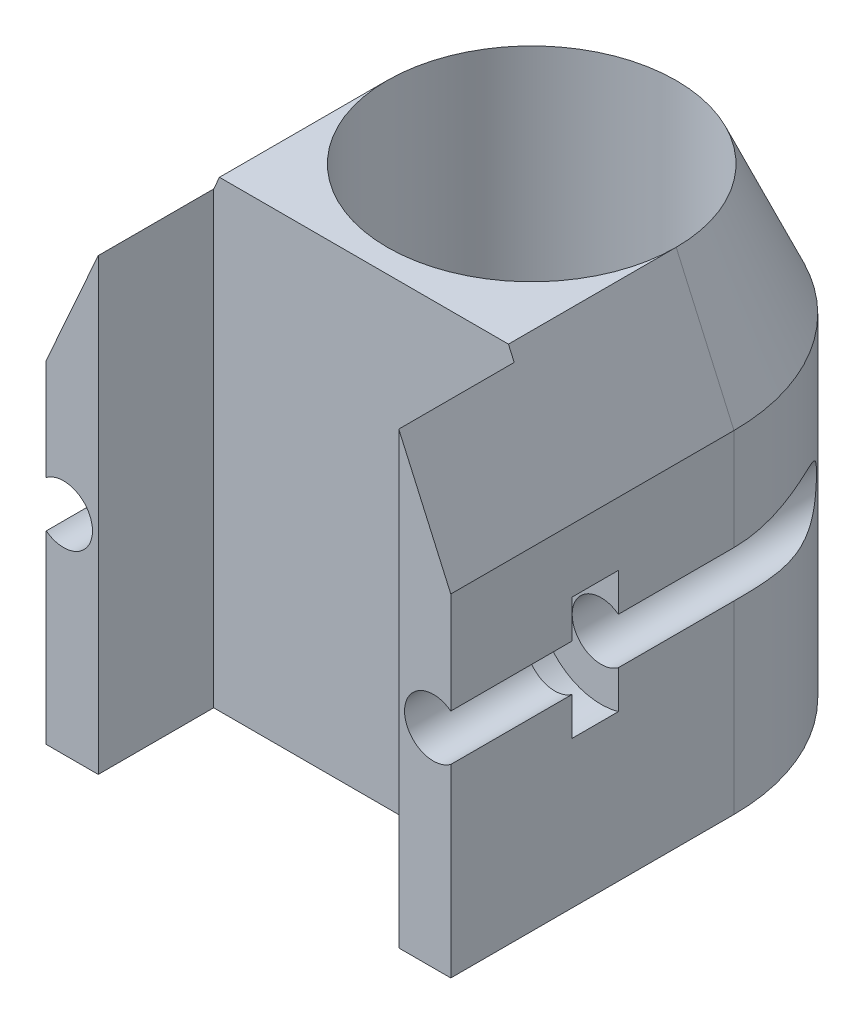
from build123d import *

# Parameters (mm, degrees)
CROQUIS1_R              = 17.5
CROQUIS1_R_2            = 12.5
SALIENTE_EXTRUIR1_DEPTH = 40
CROQUIS2_W              = 35
CROQUIS2_H              = 40
SALIENTE_EXTRUIR2_DEPTH = 30
CORTAR_EXTRUIR1_START   = -55
CROQUIS3_R              = 12.5
CORTAR_EXTRUIR1_DEPTH   = 55
CROQUIS4_W              = 26
CROQUIS4_H              = 10
CORTAR_EXTRUIR2_DEPTH   = 55
CROQUIS5_R              = 2.5
CORTAR_EXTRUIR3_DEPTH   = 55
CHAFL_N1_SIZE           = 5
CHAFL_N1_SIZE_2         = 11.23018387
CROQUIS6_W              = 43.374633734
CROQUIS6_H              = 44.438316851
CORTAR_EXTRUIR4_DEPTH   = 5.5
CROQUIS7_R              = 5.5
CORTAR_EXTRUIR5_DEPTH   = 4


with BuildPart() as part:
    # Croquis1 → Saliente-Extruir1 (new body)
    with BuildSketch(Plane(origin=(0, 0, 0), x_dir=(1, 0, 0), z_dir=(0, 1, 0))):
        with Locations(Location((0, 0, 0), (0, 0, 270))):
            Circle(CROQUIS1_R)
        with Locations(Location((0, 0, 0), (0, 0, 270))):
            Circle(CROQUIS1_R_2, mode=Mode.SUBTRACT)
    extrude(amount=SALIENTE_EXTRUIR1_DEPTH)

    # Croquis2 → Saliente-Extruir2 (add)
    with BuildSketch(Plane.XY):
        with Locations((0, 20)):
            Rectangle(CROQUIS2_W, CROQUIS2_H)
    extrude(amount=SALIENTE_EXTRUIR2_DEPTH)

    # Croquis3 → Cortar-Extruir1 (cut)
    with BuildSketch(Plane(origin=(0, 40, 0), x_dir=(1, 0, 0), z_dir=(0, 1, 0)).offset(CORTAR_EXTRUIR1_START)):
        with Locations(Location((0, 0, 0), (0, 0, 270))):
            Circle(CROQUIS3_R)
    extrude(amount=CORTAR_EXTRUIR1_DEPTH, mode=Mode.SUBTRACT)

    # Croquis4 → Cortar-Extruir2 (cut)
    with BuildSketch(Plane(origin=(0, 40, 0), x_dir=(1, 0, 0), z_dir=(0, 1, 0))):
        with Locations((0, -19.512798854)):
            Rectangle(CROQUIS4_W, CROQUIS4_H)
    extrude(amount=-CORTAR_EXTRUIR2_DEPTH, mode=Mode.SUBTRACT)

    # Croquis5 → Cortar-Extruir3 (cut)
    with BuildSketch(Plane.XY.offset(30)):
        with Locations((16, 18)):
            Circle(CROQUIS5_R)
        with Locations((-16, 18)):
            Circle(CROQUIS5_R)
    extrude(amount=-CORTAR_EXTRUIR3_DEPTH, mode=Mode.SUBTRACT)

    # Chaflán1
    # the kernel refuses this chamfer: 11.23018387, 5 mm, written as the material it takes off along each edge
    with BuildSketch(Plane(origin=(17.5, 40, 0), x_dir=(-0.9968798599783936, 0.07893379991777015, 0), z_dir=(0, 0, 1))) as chafl_n1_piece_1:
        Polygon((CHAFL_N1_SIZE * 0.996879859978, CHAFL_N1_SIZE * 0.0789337999178), (-CHAFL_N1_SIZE_2 * 0.0789337999144, CHAFL_N1_SIZE_2 * 0.996879859936), (0, 0), align=None)
    extrude(amount=59.104972531, mode=Mode.SUBTRACT)
    with BuildSketch(Plane(origin=(-17.5, 40, 0), x_dir=(0.9968798599783936, 0.07893379991777015, 0), z_dir=(0, 0, 1))) as chafl_n1_piece_2:
        Polygon((CHAFL_N1_SIZE * 0.996879859978, -CHAFL_N1_SIZE * 0.0789337999178), (-CHAFL_N1_SIZE_2 * 0.0789337999144, -CHAFL_N1_SIZE_2 * 0.996879859936), (0, 0), align=None)
    extrude(amount=59.104972531, mode=Mode.SUBTRACT)
    with BuildSketch(Plane(origin=(0, 40, 0), x_dir=(1, 0, 0), z_dir=(0, 0, 1))) as chafl_n1_piece_3:
        Polygon((17.5 - CHAFL_N1_SIZE, 0), (17.5, -CHAFL_N1_SIZE_2), (17.5, 0), align=None)
    revolve(axis=Axis((0, 40, 0), (0, 1, 0)), revolution_arc=180, mode=Mode.SUBTRACT)

    # Croquis6 → Cortar-Extruir4 (cut)
    with BuildSketch(Plane.XY.offset(30)):
        with Locations((0, 20.325014285)):
            Rectangle(CROQUIS6_W, CROQUIS6_H)
    extrude(amount=-CORTAR_EXTRUIR4_DEPTH, mode=Mode.SUBTRACT)

    # Croquis7 → Cortar-Extruir5 (cut)
    with BuildSketch(Plane.XY.offset(14)):
        with Locations((-16, 18)):
            Circle(CROQUIS7_R)
    cortar_extruir5 = extrude(amount=-CORTAR_EXTRUIR5_DEPTH, mode=Mode.SUBTRACT)

    # Simetría1: Cortar-Extruir5 across plane
    add(cortar_extruir5.mirror(Plane(origin=(0, 0, 0), x_dir=(0, 0, 1), z_dir=(1, 0, 0))), mode=Mode.SUBTRACT)


solid = part.part
